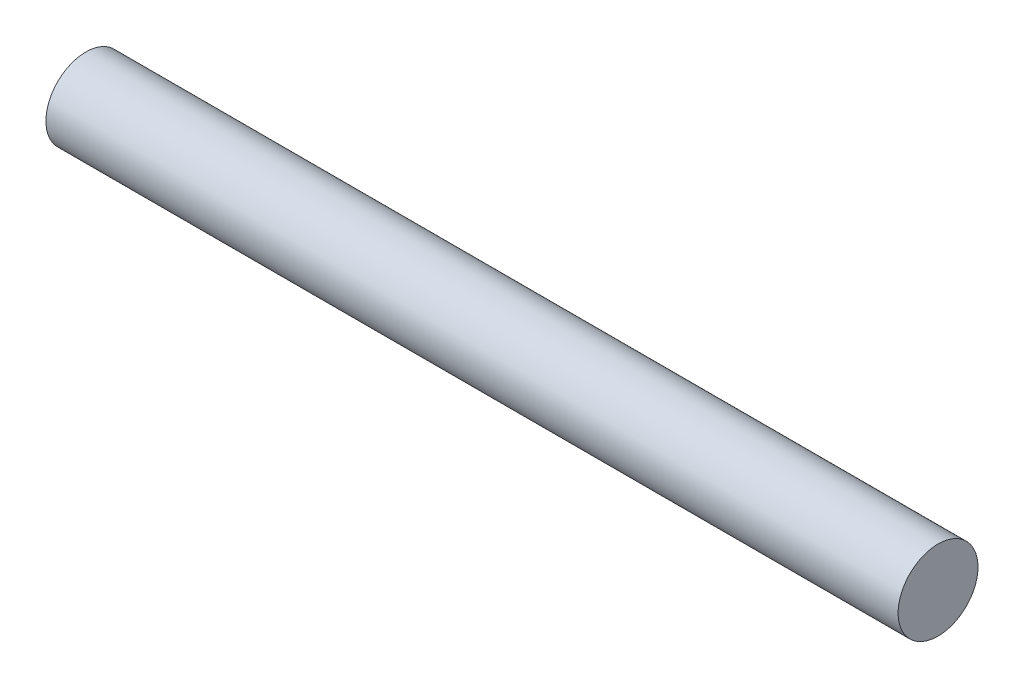
from build123d import *

# Parameters (mm, degrees)
SKETCH1_R           = 1.5
BOSS_EXTRUDE1_DEPTH = 16


with BuildPart() as part:
    # Sketch1 → Boss-Extrude1 (new, symmetric)
    with BuildSketch(Plane(origin=(0, 0, 0), x_dir=(0, 0, -1), z_dir=(1, 0, 0))):
        Circle(SKETCH1_R)
    extrude(amount=BOSS_EXTRUDE1_DEPTH, both=True)


solid = part.part
